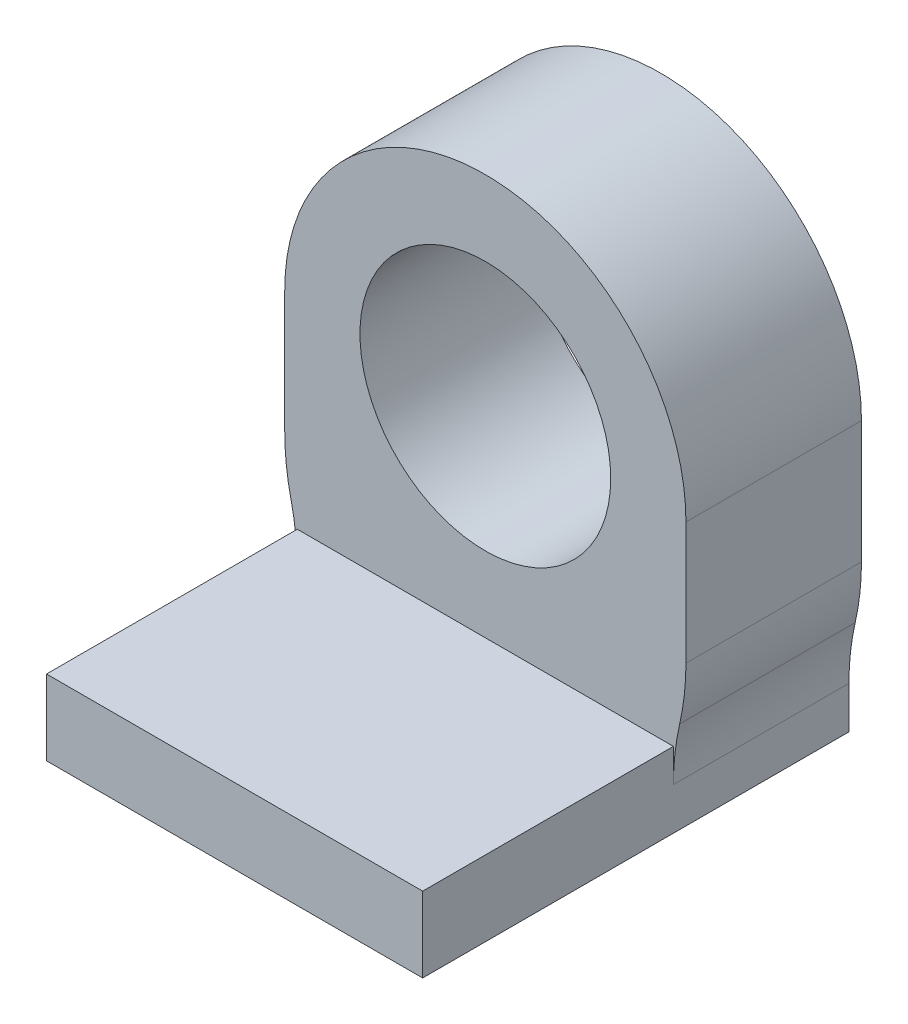
from build123d import *

# Parameters (mm, degrees)
SKETCH1_R           = 5
BOSS_EXTRUDE1_DEPTH = 7
SKETCH2_W           = 15
SKETCH2_H           = 3
BOSS_EXTRUDE2_DEPTH = 10
FILLET1_R           = 10
FILLET2_R           = 10


with BuildPart() as part:
    # Sketch1 → Boss-Extrude1 (new body)
    with BuildSketch(Plane.XY):
        with BuildLine():
            Line((-8, 0), (-8, -8))
            Line((-8, -8), (-7.5, -8))
            Line((-7.5, -8), (-7.5, -11))
            Line((-7.5, -11), (7.5, -11))
            Line((7.5, -11), (7.5, -8))
            Line((7.5, -8), (8, -8))
            Line((8, -8), (8, 0))
            ThreePointArc((8, 0), (0, 8), (-8, 0))
        make_face()
        Circle(SKETCH1_R, mode=Mode.SUBTRACT)
    extrude(amount=BOSS_EXTRUDE1_DEPTH)

    # Sketch2 → Boss-Extrude2 (add)
    with BuildSketch(Plane.XY.offset(7)):
        with Locations((0, -9.5)):
            Rectangle(SKETCH2_W, SKETCH2_H)
    extrude(amount=BOSS_EXTRUDE2_DEPTH)

    # Fillet1
    # the kernel refuses this fillet: 10 mm, written as the material it takes off along each edge
    with BuildSketch(Plane(origin=(-8, -8, -7.806247498), x_dir=(0, 1, 0), z_dir=(0, 0, 1))) as fillet1_piece_1:
        with BuildLine():
            CenterArc((3.122498999, -10), FILLET1_R, 90, 18.194872339)
            Line((0, -0.5), (0, 0))
            Line((0, 0), (3.122498999, 0))
        make_face()
    extrude(amount=22.612494996, mode=Mode.SUBTRACT)
    with BuildSketch(Plane(origin=(8, -8, -7.806247498), x_dir=(-1.0, 2.199129767162818e-12, 0), z_dir=(0, 0, 1))) as fillet1_piece_2:
        with BuildLine():
            CenterArc((10, -3.122498999), FILLET1_R, 161.805127661, 18.194872339)
            Line((0, -3.122498999), (0, 0))
            Line((0, 0), (0.5, 0))
        make_face()
    extrude(amount=22.612494996, mode=Mode.SUBTRACT)

    # Fillet2
    fillet2_edges = [part.edges().sort_by_distance(p)[0] for p in [
        (7.5, -8, 3.5),
        (-7.5, -8, 3.5),
    ]]
    fillet(fillet2_edges, radius=FILLET2_R)


solid = part.part
